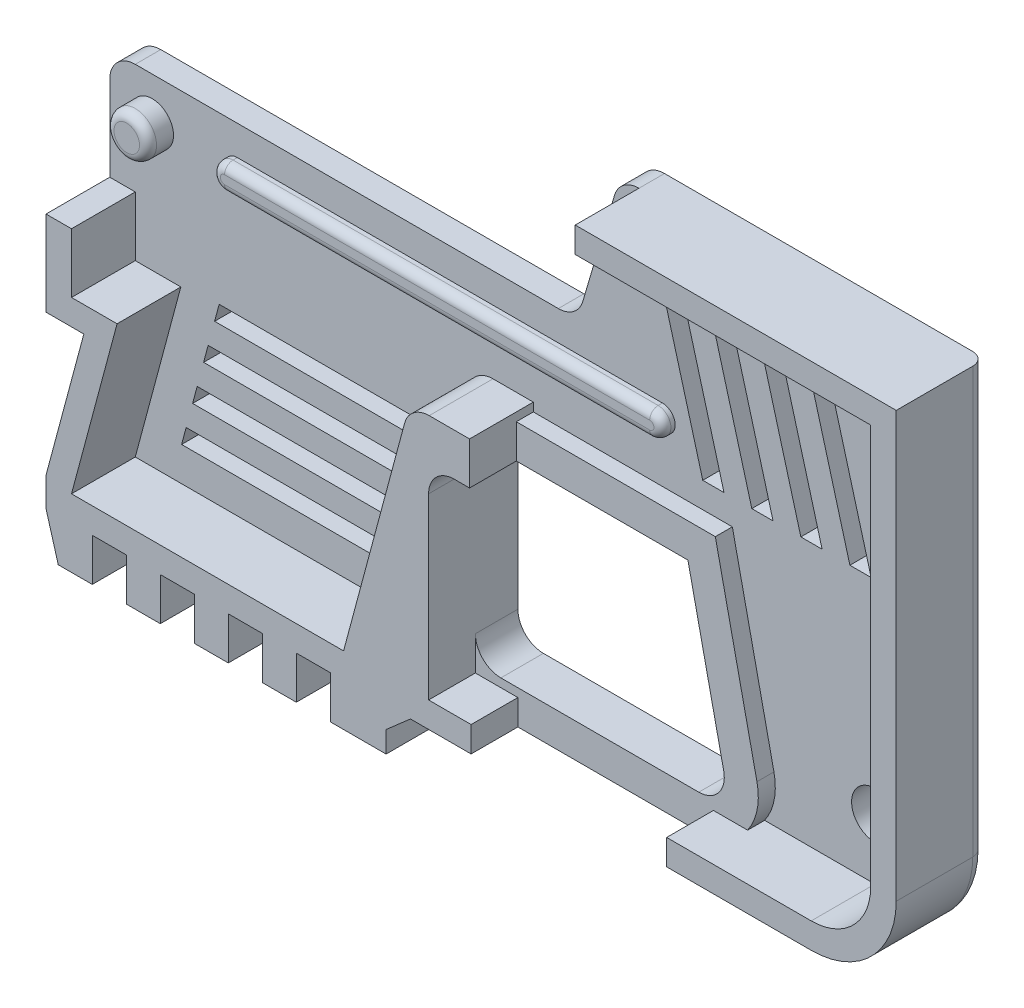
from build123d import *

# Parameters (mm, degrees)
BOSS_EXTRUDE1_DEPTH = 3
CUT_EXTRUDE1_DEPTH  = 70.878465925
BOSS_EXTRUDE2_DEPTH = 7.5
BOSS_EXTRUDE3_START = 2
BOSS_EXTRUDE3_DEPTH = 2
CUT_EXTRUDE2_DEPTH  = 71.215738976
BOSS_EXTRUDE4_DEPTH = 7.5
CUT_EXTRUDE3_DEPTH  = 71.599220959
BOSS_EXTRUDE5_START = 7.5
BOSS_EXTRUDE5_DEPTH = 7.5
SKETCH10_R          = 2.5
BOSS_EXTRUDE6_DEPTH = 3
FILLET2_R           = 1
SKETCH11_R          = 2.75
CUT_EXTRUDE5_DEPTH  = 71.215738976
FILLET3_R           = 1.5
CUT_EXTRUDE6_DEPTH  = 71.215738976
BOSS_EXTRUDE7_DEPTH = 10.5
CHAMFER1_SIZE       = 1
SKETCH14_W          = 4
SKETCH14_H          = 5.009213965
CUT_EXTRUDE7_DEPTH  = 74.75726829
BOSS_EXTRUDE8_DEPTH = 1.5
FILLET4_R           = 1


with BuildPart() as part:
    # Sketch1 → Boss-Extrude1 (new body)
    with BuildSketch(Plane.XY):
        with BuildLine():
            Line((0.633382655, 2.153501028), (4.366617345, 14.846498972))
            ThreePointArc((4.366617345, 14.846498972), (5.447423794, 16.40203007), (7.244713849, 17))
            Line((7.244713849, 17), (45, 17))
            Line((45, 17), (45, -33))
            ThreePointArc((45, -33), (42.071067812, -40.071067812), (35, -43))
            Line((35, -43), (-55, -43))
            Line((-55, -43), (-55, -3))
            ThreePointArc((-55, -3), (-54.121320344, -0.878679656), (-52, 0))
            Line((-52, 0), (-2.244713849, 0))
            ThreePointArc((-2.244713849, 0), (-0.447423794, 0.59796993), (0.633382655, 2.153501028))
        make_face()
    extrude(amount=BOSS_EXTRUDE1_DEPTH)

    # Sketch2 → Cut-Extrude1 (cut, through all)
    with BuildSketch(Plane.XY.offset(3)):
        with BuildLine():
            Line((-7, -16), (15, -16))
            Line((15, -16), (19.209285015, -35.362711067))
            ThreePointArc((19.209285015, -35.362711067), (18.613549878, -37.882569149), (16.277755923, -39))
            Line((16.277755923, -39), (-7, -39))
            ThreePointArc((-7, -39), (-9.121320344, -38.121320344), (-10, -36))
            Line((-10, -36), (-10, -19))
            ThreePointArc((-10, -19), (-9.121320344, -16.878679656), (-7, -16))
        make_face()
    extrude(amount=-CUT_EXTRUDE1_DEPTH, mode=Mode.SUBTRACT)

    # Sketch3 → Boss-Extrude2 (add)
    with BuildSketch(Plane.XY.offset(3)):
        with BuildLine():
            Line((45, -33), (45, 17))
            Line((45, 17), (7.244713849, 17))
            Line((7.244713849, 17), (7.244713849, 14))
            Line((7.244713849, 14), (42, 14))
            Line((42, 14), (42, -33))
            ThreePointArc((42, -33), (39.949747468, -37.949747468), (35, -40))
            Line((35, -40), (18, -40))
            Line((18, -40), (18, -43))
            Line((18, -43), (35, -43))
            ThreePointArc((35, -43), (42.071067812, -40.071067812), (45, -33))
        make_face()
        Polygon((-5, -43), (-55, -43), (-55, -13), (-52, -13), (-52, -40), (-5, -40), align=None)
    extrude(amount=BOSS_EXTRUDE2_DEPTH)

    # Sketch4 → Boss-Extrude3 (add)
    with BuildSketch(Plane.XY.offset(3).offset(BOSS_EXTRUDE3_START)):
        with BuildLine():
            Line((18.223861668, -12), (-7, -12))
            ThreePointArc((-7, -12), (-11.949747468, -14.050252532), (-14, -19))
            Line((-14, -19), (-14, -36))
            ThreePointArc((-14, -36), (-11.949747468, -40.949747468), (-7, -43))
            Line((-7, -43), (16.277755923, -43))
            ThreePointArc((16.277755923, -43), (21.727941817, -40.392661348), (23.11799047, -34.51299249))
            Line((23.11799047, -34.51299249), (18.223861668, -12))
        make_face()
        with BuildLine():
            Line((15, -16), (-7, -16))
            ThreePointArc((-7, -16), (-9.121320344, -16.878679656), (-10, -19))
            Line((-10, -19), (-10, -36))
            ThreePointArc((-10, -36), (-9.121320344, -38.121320344), (-7, -39))
            Line((-7, -39), (16.277755923, -39))
            ThreePointArc((16.277755923, -39), (18.613549878, -37.882569149), (19.209285015, -35.362711067))
            Line((19.209285015, -35.362711067), (15, -16))
        make_face(mode=Mode.SUBTRACT)
    extrude(amount=-BOSS_EXTRUDE3_DEPTH)

    # Sketch5 → Cut-Extrude2 (cut, through all)
    with BuildSketch(Plane.XY.offset(3)):
        Polygon((9.244713849, 11), (14.744713849, -9), (17.244713849, -9), (11.744713849, 11), align=None)
        Polygon((23.012478168, -9), (17.512478168, 11), (15.012478168, 11), (20.512478168, -9), align=None)
        Polygon((28.780242487, -9), (23.280242487, 11), (20.780242487, 11), (26.280242487, -9), align=None)
        Polygon((34.548006805, -9), (29.048006805, 11), (26.548006805, 11), (32.048006805, -9), align=None)
    extrude(amount=-CUT_EXTRUDE2_DEPTH, mode=Mode.SUBTRACT)

    # Sketch6 → Boss-Extrude4 (add)
    with BuildSketch(Plane.XY.offset(3)):
        Polygon((-52, -40), (-46.641016151, -20), (-52, -20), align=None)
    extrude(amount=BOSS_EXTRUDE4_DEPTH)

    # Sketch7 → Cut-Extrude3 (cut, through all)
    with BuildSketch(Plane.XY.offset(10.5)):
        Polygon((-55, -39.605042507), (-55, -23), (-50.55069227, -23), align=None)
    extrude(amount=-CUT_EXTRUDE3_DEPTH, mode=Mode.SUBTRACT)

    # Sketch8 → Boss-Extrude5 (add)
    with BuildSketch(Plane.XY.offset(3).offset(BOSS_EXTRUDE5_START)):
        with BuildLine():
            Line((-10, -40), (-10, -19))
            ThreePointArc((-10, -19), (-9.121320344, -16.878679656), (-7, -16))
            Line((-7, -16), (-5.183058398, -16))
            Line((-5.183058398, -16), (-5.183058398, -11))
            Line((-5.183058398, -11), (-9.927492456, -11))
            ThreePointArc((-9.927492456, -11), (-11.753776743, -11.619939979), (-12.825269934, -13.223542865))
            Line((-12.825269934, -13.223542865), (-20, -40))
            Line((-20, -40), (-10, -40))
        make_face()
    extrude(amount=-BOSS_EXTRUDE5_DEPTH)

    # Sketch10 → Boss-Extrude6 (add)
    with BuildSketch(Plane.XY.offset(3)):
        with Locations((-50, -5)):
            Circle(SKETCH10_R)
    extrude(amount=BOSS_EXTRUDE6_DEPTH)

    # Fillet2
    fillet2_edges = [part.edges().sort_by_distance(p)[0] for p in [
        (-52.5, -5, 6),
    ]]
    fillet(fillet2_edges, radius=FILLET2_R)

    # Sketch11 → Cut-Extrude5 (cut, through all)
    with BuildSketch(Plane.XY.offset(3)):
        with Locations((35, -33)):
            Circle(SKETCH11_R)
    extrude(amount=-CUT_EXTRUDE5_DEPTH, mode=Mode.SUBTRACT)

    # Fillet3
    fillet3_edges = [part.edges().sort_by_distance(p)[0] for p in [
        (-10, -43, 0),
        (42.071067812, -40.071067812, 0),
        (45, -8, 0),
    ]]
    fillet(fillet3_edges, radius=FILLET3_R)

    # Sketch12 → Cut-Extrude6 (cut, through all)
    with BuildSketch(Plane.XY.offset(3)):
        Polygon((-46.551669862, -36), (-22.551669862, -36), (-22.015771477, -34), (-46.015771477, -34), align=None)
        Polygon((-45.257574636, -31.170370869), (-21.257574636, -31.170370869), (-20.721676251, -29.170370869), (-44.721676251, -29.170370869), align=None)
        Polygon((-43.963479411, -26.340741737), (-19.963479411, -26.340741737), (-19.427581026, -24.340741737), (-43.427581026, -24.340741737), align=None)
        Polygon((-42.669384185, -21.511112606), (-18.669384185, -21.511112606), (-18.1334858, -19.511112606), (-42.1334858, -19.511112606), align=None)
    extrude(amount=-CUT_EXTRUDE6_DEPTH, mode=Mode.SUBTRACT)

    # Sketch13 → Boss-Extrude7 (add)
    with BuildSketch(Plane.XY):
        Polygon((-55, -43), (-53.558551653, -48.009213965), (-14.997432238, -48.009213965), (-14.997432238, -45.504606983), (-12.13347642, -43), align=None)
    extrude(amount=BOSS_EXTRUDE7_DEPTH)

    # Chamfer1
    chamfer1_edges = [part.edges().sort_by_distance(p)[0] for p in [
        (-33.56673821, -43, 0),
        (-34.277991946, -48.009213965, 0),
    ]]
    chamfer(chamfer1_edges, length=CHAMFER1_SIZE)

    # Sketch14 → Cut-Extrude7 (cut, through all)
    with BuildSketch(Plane.XY.offset(10.5)):
        with Locations((-47.558551653, -45.504606983)):
            Rectangle(SKETCH14_W, SKETCH14_H)
        with Locations((-39.558551653, -45.504606983)):
            Rectangle(SKETCH14_W, SKETCH14_H)
        with Locations((-31.558551653, -45.504606983)):
            Rectangle(SKETCH14_W, SKETCH14_H)
        with Locations((-23.558551653, -45.504606983)):
            Rectangle(SKETCH14_W, SKETCH14_H)
    extrude(amount=-CUT_EXTRUDE7_DEPTH, mode=Mode.SUBTRACT)

    # Sketch9 → Boss-Extrude8 (add)
    with BuildSketch(Plane.XY.offset(3)):
        with BuildLine():
            Line((-40, -3.5), (10, -3.5))
            ThreePointArc((10, -3.5), (11.5, -5), (10, -6.5))
            Line((10, -6.5), (-40, -6.5))
            ThreePointArc((-40, -6.5), (-41.5, -5), (-40, -3.5))
        make_face()
    extrude(amount=BOSS_EXTRUDE8_DEPTH)

    # Fillet4
    fillet4_edges = [part.edges().sort_by_distance(p)[0] for p in [
        (-15, -3.5, 4.5),
        (11.5, -5, 4.5),
        (-15, -6.5, 4.5),
        (-41.5, -5, 4.5),
    ]]
    fillet(fillet4_edges, radius=FILLET4_R)


solid = part.part
